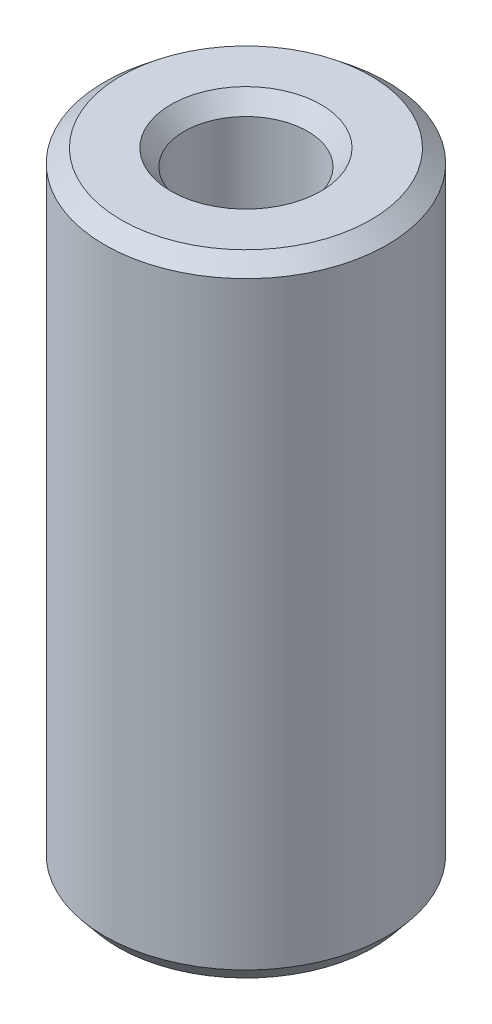
from build123d import *
from OCP.BRepFilletAPI import BRepFilletAPI_MakeChamfer

# Parameters (mm, degrees)
SKETCH1_R           = 20
BOSS_EXTRUDE1_DEPTH = 88.995925146
SKETCH2_R           = 8.726221912
CUT_EXTRUDE1_DEPTH  = 94.382411045
CHAMFER1_SIZE       = 1.900307732
CHAMFER1_SIZE2      = 2.32493534


with BuildPart() as part:
    # Sketch1 → Boss-Extrude1 (new body)
    with BuildSketch(Plane(origin=(0, 0, 0), x_dir=(1, 0, 0), z_dir=(0, 1, 0))):
        Circle(SKETCH1_R)
    extrude(amount=BOSS_EXTRUDE1_DEPTH)

    # Sketch2 → Cut-Extrude1 (cut, through all)
    with BuildSketch(Plane(origin=(0, 0, 0), x_dir=(1, 0, 0), z_dir=(0, 1, 0))):
        Circle(SKETCH2_R)
    extrude(amount=CUT_EXTRUDE1_DEPTH, mode=Mode.SUBTRACT)

    # Chamfer1: one chamfer whose edges measure the first distance from different faces: ONE call of the kernel's chamfer builder (chamfer() names one face for all edges)
    chamfer1_edges_1 = [part.edges().sort_by_distance(p)[0] for p in [
        (-8.726221912, 88.995925146, 0),
    ]]
    chamfer1_side_1 = [part.faces().sort_by_distance(p)[0] for p in [
        (-19.434314575, 88.995925146, 0),
    ]]
    chamfer1_edges_2 = [part.edges().sort_by_distance(p)[0] for p in [
        (-8.726221912, 0, 0),
    ]]
    chamfer1_side_2 = [part.faces().sort_by_distance(p)[0] for p in [
        (-8.726221912, 44.497962573, 0),
    ]]
    chamfer1_edges_3 = [part.edges().sort_by_distance(p)[0] for p in [
        (-20, 0, 0),
    ]]
    chamfer1_side_3 = [part.faces().sort_by_distance(p)[0] for p in [
        (-19.434314575, 0, 0),
    ]]
    chamfer1_edges_4 = [part.edges().sort_by_distance(p)[0] for p in [
        (-20, 88.995925146, 0),
    ]]
    chamfer1_side_4 = [part.faces().sort_by_distance(p)[0] for p in [
        (-20, 44.497962573, 0),
    ]]
    chamfer1 = BRepFilletAPI_MakeChamfer(part.part.solid().wrapped)
    for e in chamfer1_edges_1:
        chamfer1.Add(CHAMFER1_SIZE, CHAMFER1_SIZE2, e.wrapped, chamfer1_side_1[0].wrapped)  # the first distance lies on this face
    for e in chamfer1_edges_2:
        chamfer1.Add(CHAMFER1_SIZE, CHAMFER1_SIZE2, e.wrapped, chamfer1_side_2[0].wrapped)  # the first distance lies on this face
    for e in chamfer1_edges_3:
        chamfer1.Add(CHAMFER1_SIZE, CHAMFER1_SIZE2, e.wrapped, chamfer1_side_3[0].wrapped)  # the first distance lies on this face
    for e in chamfer1_edges_4:
        chamfer1.Add(CHAMFER1_SIZE, CHAMFER1_SIZE2, e.wrapped, chamfer1_side_4[0].wrapped)  # the first distance lies on this face
    add(Compound.cast(chamfer1.Shape()), mode=Mode.REPLACE)


solid = part.part
